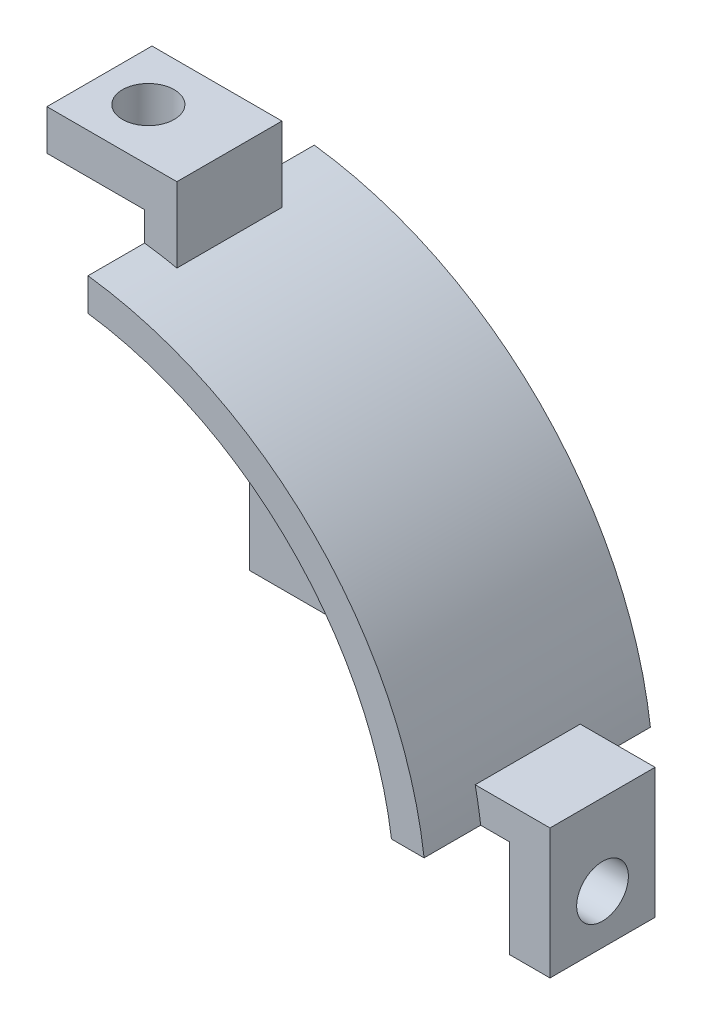
from build123d import *

# Parameters (mm, degrees)
BOSS_EXTRUDE1_DEPTH   = 14.5
M3_CLEARANCE_HOLE1_D  = 3.2
M3_CLEARANCE_HOLE2_D  = 3.2
SKETCH6_W             = 6.05
SKETCH6_H             = 4
CUT_EXTRUDE1_DEPTH    = 10
SKETCH7_W             = 4
SKETCH7_H             = 6.05
CUT_EXTRUDE2_DEPTH    = 10
BOSS_EXTRUDE7_DEPTH   = 14
SKETCH14_W            = 57.002666796
SKETCH14_H            = 41.192482136
CUT_EXTRUDE4_DEPTH    = 15
CUT_EXTRUDE5_DEPTH    = 10
CUT_EXTRUDE8_DEPTH    = 20
CUT_EXTRUDE9_DEPTH    = 4
CUT_EXTRUDE9_START    = 10.5
CUT_EXTRUDE9_2_DEPTH  = 3.5
CUT_EXTRUDE10_DEPTH   = 4
CUT_EXTRUDE10_START   = 10.5
CUT_EXTRUDE10_2_DEPTH = 3.5


# Read off the part's stored shape, not the designer's step: Cut-Extrude9, Cut-Extrude10
with BuildPart() as part:
    # Sketch1 → Boss-Extrude1 (new body)
    with BuildSketch(Plane.XY):
        with BuildLine():
            Line((3.025, 25.6), (-3.025, 25.6))
            Line((-3.025, 25.6), (-3.025, 28.1))
            Line((-3.025, 28.1), (3.025, 28.1))
            ThreePointArc((3.025, 28.1), (21.312111091, 21.312111091), (28.1, 3.025))
            Line((28.1, 3.025), (28.1, -3.025))
            Line((28.1, -3.025), (25.6, -3.025))
            Line((25.6, -3.025), (25.6, 3.025))
            ThreePointArc((25.6, 3.025), (18.987935585, 18.987935585), (3.025, 25.6))
        make_face()
    extrude(amount=BOSS_EXTRUDE1_DEPTH)

    # M3 Clearance Hole1 (through all)
    with Locations(Plane(origin=(0, 28.1, 0), x_dir=(1, 0, 0), z_dir=(0, 1, 0))):
        with Locations((0, -7.25)):
            Hole(M3_CLEARANCE_HOLE1_D / 2)

    # M3 Clearance Hole2 (through all)
    with Locations(Plane(origin=(28.1, 0, 0), x_dir=(0, 0, -1), z_dir=(1, 0, 0))):
        with Locations((-7.25, 0)):
            Hole(M3_CLEARANCE_HOLE2_D / 2)

    # Sketch6 → Cut-Extrude1 (cut)
    with BuildSketch(Plane(origin=(0, 28.1, 0), x_dir=(1, 0, 0), z_dir=(0, 1, 0))):
        with Locations((0, -12.5)):
            Rectangle(SKETCH6_W, SKETCH6_H)
        with Locations((0, -2)):
            Rectangle(SKETCH6_W, SKETCH6_H)
    extrude(amount=-CUT_EXTRUDE1_DEPTH, mode=Mode.SUBTRACT)

    # Sketch7 → Cut-Extrude2 (cut)
    with BuildSketch(Plane(origin=(28.1, 0, 0), x_dir=(0, 0, -1), z_dir=(1, 0, 0))):
        with Locations((-12.5, 0)):
            Rectangle(SKETCH7_W, SKETCH7_H)
        with Locations((-2, 0)):
            Rectangle(SKETCH7_W, SKETCH7_H)
    extrude(amount=-CUT_EXTRUDE2_DEPTH, mode=Mode.SUBTRACT)

    # Sketch8 → Boss-Extrude7 (add)
    with BuildSketch(Plane(origin=(0, 0, 0), x_dir=(-1, 0, 0), z_dir=(0, 0, -1))):
        with BuildLine():
            Line((-31.03541973, 3.015), (-3.015, 3.015))
            Line((-3.015, 3.015), (-3.015, 31.03541973))
            ThreePointArc((-3.015, 31.03541973), (-22.048667792, 22.048667792), (-31.03541973, 3.015))
        make_face()
    extrude(amount=-BOSS_EXTRUDE7_DEPTH)

    # Sketch14 → Cut-Extrude4 (cut)
    with BuildSketch(Plane.XY.offset(14)):
        with Locations((13.446699297, 19.415661607)):
            Rectangle(SKETCH14_W, SKETCH14_H)
    extrude(amount=CUT_EXTRUDE4_DEPTH, mode=Mode.SUBTRACT)

    # Sketch15 → Cut-Extrude5 (cut)
    with BuildSketch(Plane.XY.offset(14)):
        with BuildLine():
            Line((3.015, 21.792424716), (3.015, 3.015))
            Line((3.015, 3.015), (21.792424716, 3.015))
            ThreePointArc((21.792424716, 3.015), (15.556349186, 15.556349186), (3.015, 21.792424716))
        make_face()
    extrude(amount=-CUT_EXTRUDE5_DEPTH, mode=Mode.SUBTRACT)

    # Sketch16 → Cut-Extrude8 (cut)
    with BuildSketch(Plane.XY.offset(14)):
        with BuildLine():
            Line((5.015, 23.47018907), (5.015, 28.1))
            Line((5.015, 28.1), (3.015, 28.1))
            Line((3.015, 28.1), (3.015, 36.20716296))
            Line((3.015, 36.20716296), (34.30048071, 28.1))
            Line((34.30048071, 28.1), (32.410436515, 3.015))
            Line((32.410436515, 3.015), (28.1, 3.015))
            Line((28.1, 3.015), (28.1, 5.015))
            Line((28.1, 5.015), (23.47018907, 5.015))
            ThreePointArc((23.47018907, 5.015), (16.970562748, 16.970562748), (5.015, 23.47018907))
        make_face()
    extrude(amount=-CUT_EXTRUDE8_DEPTH, mode=Mode.SUBTRACT)

    # Cut-Extrude9 outline → Cut-Extrude9 (cut)
    with BuildSketch(Plane.XY):
        with BuildLine():
            Line((28.1, 3.015), (28.1, 5.015))
            Line((28.1, 5.015), (23.47018907, 5.015))
            ThreePointArc((23.47018907, 5.015), (23.661169237, 4.018590587), (23.809867177, 3.015))
            Line((23.809867177, 3.015), (28.1, 3.015))
        make_face()
    extrude(amount=CUT_EXTRUDE9_DEPTH, mode=Mode.SUBTRACT)

    # Cut-Extrude9 2 outline → Cut-Extrude9 2 (cut)
    with BuildSketch(Plane.XY.offset(CUT_EXTRUDE9_START)):
        with BuildLine():
            Line((28.1, 3.015), (28.1, 5.015))
            Line((28.1, 5.015), (23.47018907, 5.015))
            ThreePointArc((23.47018907, 5.015), (23.661169237, 4.018590587), (23.809867177, 3.015))
            Line((23.809867177, 3.015), (28.1, 3.015))
        make_face()
    extrude(amount=CUT_EXTRUDE9_2_DEPTH, mode=Mode.SUBTRACT)

    # Cut-Extrude10 outline → Cut-Extrude10 (cut)
    with BuildSketch(Plane.XY):
        with BuildLine():
            Line((5.015, 28.1), (3.015, 28.1))
            Line((3.015, 28.1), (3.015, 23.809867177))
            ThreePointArc((3.015, 23.809867177), (4.018590587, 23.661169237), (5.015, 23.47018907))
            Line((5.015, 23.47018907), (5.015, 28.1))
        make_face()
    extrude(amount=CUT_EXTRUDE10_DEPTH, mode=Mode.SUBTRACT)

    # Cut-Extrude10 2 outline → Cut-Extrude10 2 (cut)
    with BuildSketch(Plane.XY.offset(CUT_EXTRUDE10_START)):
        with BuildLine():
            Line((5.015, 28.1), (3.015, 28.1))
            Line((3.015, 28.1), (3.015, 23.809867177))
            ThreePointArc((3.015, 23.809867177), (4.018590587, 23.661169237), (5.015, 23.47018907))
            Line((5.015, 23.47018907), (5.015, 28.1))
        make_face()
    extrude(amount=CUT_EXTRUDE10_2_DEPTH, mode=Mode.SUBTRACT)


solid = part.part
